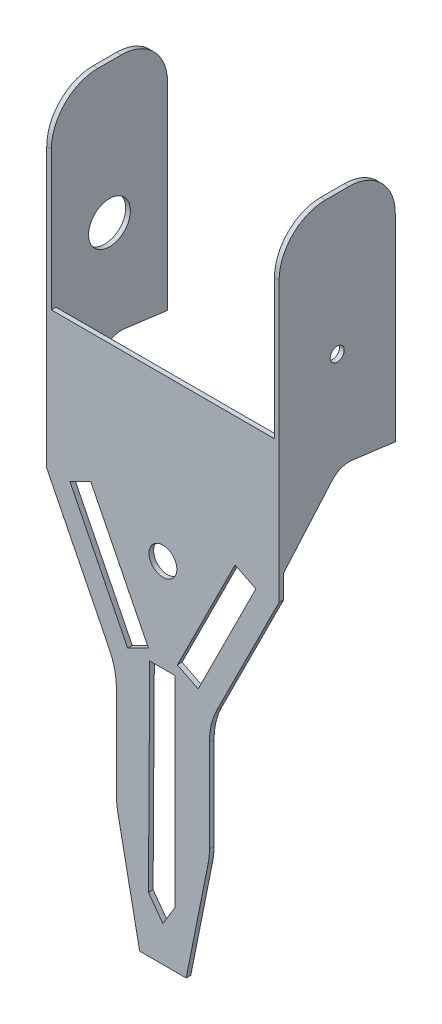
from build123d import *

# Parameters (mm, degrees)
CROQUIS2_W              = 50
CROQUIS2_H              = 150
SALIENTE_EXTRUIR1_DEPTH = 25
CROQUIS6_W              = 48
CROQUIS6_H              = 40
CORTAR_EXTRUIR1_DEPTH   = 25
VACIADO2_START          = -31.864905155
VACIADO2_OUTLINE_W      = 110
VACIADO2_OUTLINE_H      = 23
VACIADO2_DEPTH          = 48
CROQUIS8_R              = 4.5
CORTAR_EXTRUIR3_DEPTH   = 1
CROQUIS9_W              = 48
CROQUIS9_H              = 110
CORTAR_EXTRUIR4_DEPTH   = 10
CORTAR_EXTRUIR5_DEPTH   = 1
CORTAR_EXTRUIR6_DEPTH   = 1
CROQUIS12_R             = 1.5
CORTAR_EXTRUIR7_DEPTH   = 1
CROQUIS13_R             = 3
CORTAR_EXTRUIR8_DEPTH   = 10
REDONDEO1_R             = 10
CORTAR_EXTRUIR9_DEPTH   = 50


# Read off the part's stored shape, not the designer's step: Vaciado2
with BuildPart() as part:
    # Croquis2 → Saliente-Extruir1 (new body)
    with BuildSketch(Plane.XY):
        with Locations((-7.864905155, -22.416151752)):
            Rectangle(CROQUIS2_W, CROQUIS2_H)
    extrude(amount=SALIENTE_EXTRUIR1_DEPTH)

    # Croquis6 → Cortar-Extruir1 (cut)
    with BuildSketch(Plane(origin=(0, 0, 0), x_dir=(-1, 0, 0), z_dir=(0, 0, -1))):
        with Locations((7.864905155, 32.583848248)):
            Rectangle(CROQUIS6_W, CROQUIS6_H)
    extrude(amount=-CORTAR_EXTRUIR1_DEPTH, mode=Mode.SUBTRACT)

    # Vaciado2 outline → Vaciado2 (cut)
    with BuildSketch(Plane.YZ.offset(VACIADO2_START)):
        with Locations((-42.416151752, 12.5)):
            Rectangle(VACIADO2_OUTLINE_W, VACIADO2_OUTLINE_H)
    extrude(amount=VACIADO2_DEPTH, mode=Mode.SUBTRACT)

    # Croquis8 → Cortar-Extruir3 (cut)
    with BuildSketch(Plane.ZY.offset(32.864905155)):
        with Locations(Location((12.5, 22.583848248, 0), (0, 0, 270))):
            Circle(CROQUIS8_R)
    extrude(amount=-CORTAR_EXTRUIR3_DEPTH, mode=Mode.SUBTRACT)

    # Croquis9 → Cortar-Extruir4 (cut)
    with BuildSketch(Plane(origin=(0, 0, 0), x_dir=(-1, 0, 0), z_dir=(0, 0, -1))):
        with Locations((7.864905155, -42.416151752)):
            Rectangle(CROQUIS9_W, CROQUIS9_H)
    extrude(amount=-CORTAR_EXTRUIR4_DEPTH, mode=Mode.SUBTRACT)

    # Croquis10 → Cortar-Extruir5 (cut)
    with BuildSketch(Plane.ZY.offset(32.864905155)):
        Polygon((0, 0), (24, -12.416151752), (24, -97.416151752), (0, -97.416151752), align=None)
    extrude(amount=-CORTAR_EXTRUIR5_DEPTH, mode=Mode.SUBTRACT)

    # Croquis11 → Cortar-Extruir6 (cut)
    with BuildSketch(Plane(origin=(17.135094845, 0, 0), x_dir=(0, 0, -1), z_dir=(1, 0, 0))):
        Polygon((0, 0), (-24, -12.416151752), (-24, -97.416151752), (0, -97.416151752), align=None)
    extrude(amount=-CORTAR_EXTRUIR6_DEPTH, mode=Mode.SUBTRACT)

    # Croquis12 → Cortar-Extruir7 (cut)
    with BuildSketch(Plane(origin=(17.135094845, 0, 0), x_dir=(0, 0, -1), z_dir=(1, 0, 0))):
        with Locations(Location((-12.5, 22.583848248, 0), (0, 0, 90))):
            Circle(CROQUIS12_R)
    extrude(amount=-CORTAR_EXTRUIR7_DEPTH, mode=Mode.SUBTRACT)

    # Croquis13 → Cortar-Extruir8 (cut)
    with BuildSketch(Plane.XY.offset(25)):
        with Locations((-7.864905155, -22.248967482)):
            Circle(CROQUIS13_R)
        with BuildLine():
            Line((-17.864905155, -50.957171414), (-17.864905155, -70.930859048))
            ThreePointArc((-17.864905155, -70.930859048), (-17.791905055, -72.408923317), (-17.57361529, -73.872601075))
            Line((-17.57361529, -73.872601075), (-12.864905155, -97.416151752))
            Line((-12.864905155, -97.416151752), (-32.864905155, -97.416151752))
            Line((-32.864905155, -97.416151752), (-32.864905155, -17.416151752))
            Line((-32.864905155, -17.416151752), (-19.44849729, -44.248967482))
            ThreePointArc((-19.44849729, -44.248967482), (-18.266170313, -47.510877606), (-17.864905155, -50.957171414))
        make_face()
        Polygon((-27.864905155, -17.416151752), (-23.3927692, -15.180083774), (-10.976361335, -40.012899504), (-15.44849729, -42.248967482), align=None)
        with BuildLine():
            Line((-2.864905155, -97.416151752), (1.84380498, -73.872601075))
            ThreePointArc((1.84380498, -73.872601075), (2.062094745, -72.408923317), (2.135094845, -70.930859048))
            Line((2.135094845, -70.930859048), (2.135094845, -50.957171414))
            ThreePointArc((2.135094845, -50.957171414), (2.536360003, -47.510877606), (3.71868698, -44.248967482))
            Line((3.71868698, -44.248967482), (17.135094845, -17.416151752))
            Line((17.135094845, -17.416151752), (17.135094845, -97.416151752))
            Line((17.135094845, -97.416151752), (-2.864905155, -97.416151752))
        make_face()
        Polygon((12.135094845, -17.416151752), (-0.28131302, -42.248967482), (-4.753448975, -40.012899504), (7.66295889, -15.180083774), align=None)
        Polygon((-7.864905155, -42.248967482), (-5.285539059, -42.248967482), (-5.285539059, -85.512580171), (-7.864905155, -89.795904878), (-10.976361335, -85.512580171), (-10.709188819, -42.248967482), align=None)
    extrude(amount=-CORTAR_EXTRUIR8_DEPTH, mode=Mode.SUBTRACT)

    # Redondeo1
    redondeo1_edges = [part.edges().sort_by_distance(p)[0] for p in [
        (16.635094845, 52.583848248, 25),
        (-32.364905155, 52.583848248, 0),
        (-32.364905155, 52.583848248, 25),
        (16.635094845, 52.583848248, 0),
    ]]
    fillet(redondeo1_edges, radius=REDONDEO1_R)

    # Croquis14 → Cortar-Extruir9 (cut)
    with BuildSketch(Plane.ZY.offset(32.864905155)):
        with BuildLine():
            Line((0, 0), (9.235899895, 1.20073778))
            ThreePointArc((9.235899895, 1.20073778), (11.659366349, 0.915331151), (13.659135181, -0.483086245))
            Line((13.659135181, -0.483086245), (24, -12.416151752))
            Line((24, -12.416151752), (0, 0))
        make_face()
    extrude(amount=-CORTAR_EXTRUIR9_DEPTH, mode=Mode.SUBTRACT)


solid = part.part
